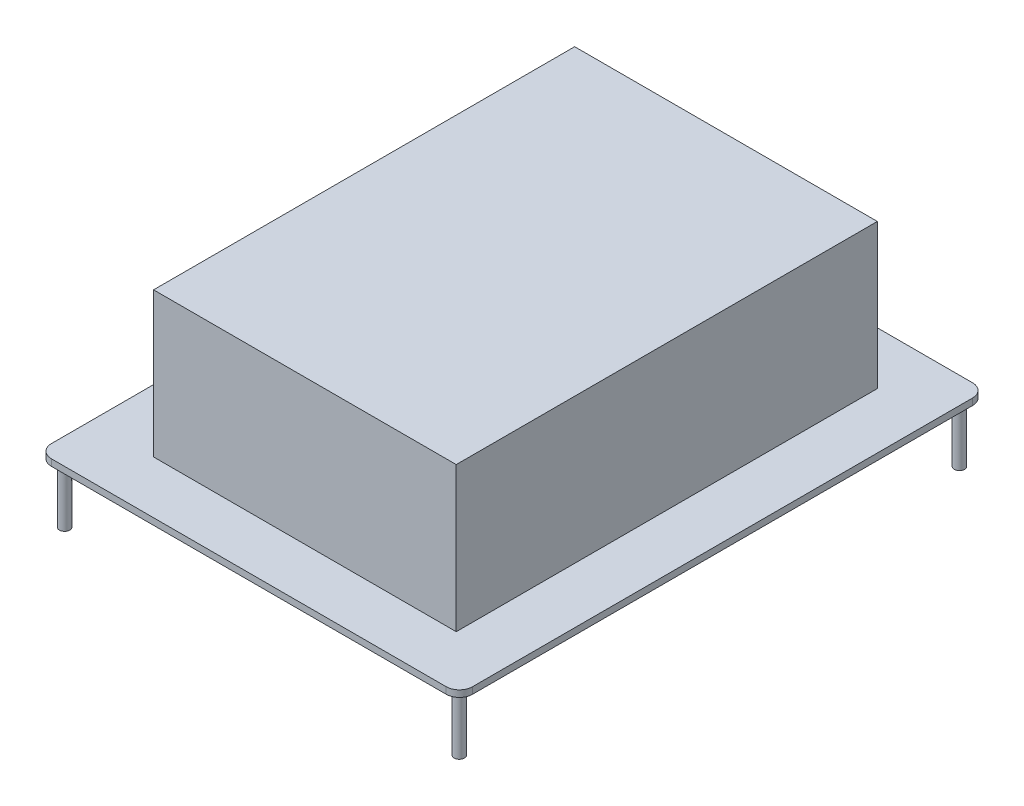
from build123d import *

# Parameters (mm, degrees)
SKETCH1_W           = 81.28
SKETCH1_H           = 101.6
BOSS_EXTRUDE1_DEPTH = 1.27
SKETCH2_W           = 58.42
SKETCH2_H           = 81.28
BOSS_EXTRUDE2_DEPTH = 27.94
FILLET1_R           = 2.54
SKETCH4_R           = 1
BOSS_EXTRUDE3_DEPTH = 11.43


with BuildPart() as part:
    # Sketch1 → Boss-Extrude1 (new body)
    with BuildSketch(Plane(origin=(0, 0, 0), x_dir=(1, 0, 0), z_dir=(0, 1, 0))):
        Rectangle(SKETCH1_W, SKETCH1_H)
    extrude(amount=BOSS_EXTRUDE1_DEPTH)

    # Sketch2 → Boss-Extrude2 (add)
    with BuildSketch(Plane(origin=(0, 1.27, 0), x_dir=(1, 0, 0), z_dir=(0, 1, 0))):
        with Locations((0.667132778, 0)):
            Rectangle(SKETCH2_W, SKETCH2_H)
    extrude(amount=BOSS_EXTRUDE2_DEPTH)

    # Fillet1
    fillet1_edges = [part.edges().sort_by_distance(p)[0] for p in [
        (-40.64, 0.635, -50.8),
        (40.64, 0.635, -50.8),
        (40.64, 0.635, 50.8),
        (-40.64, 0.635, 50.8),
    ]]
    fillet(fillet1_edges, radius=FILLET1_R)

    # Sketch4 → Boss-Extrude3 (add)
    with BuildSketch(Plane.XZ):
        with Locations((38.1, 48.26)):
            Circle(SKETCH4_R)
        with Locations((38.1, -48.26)):
            Circle(SKETCH4_R)
        with Locations((-38.1, 48.26)):
            Circle(SKETCH4_R)
        with Locations((-38.1, -48.26)):
            Circle(SKETCH4_R)
    extrude(amount=BOSS_EXTRUDE3_DEPTH)


solid = part.part
